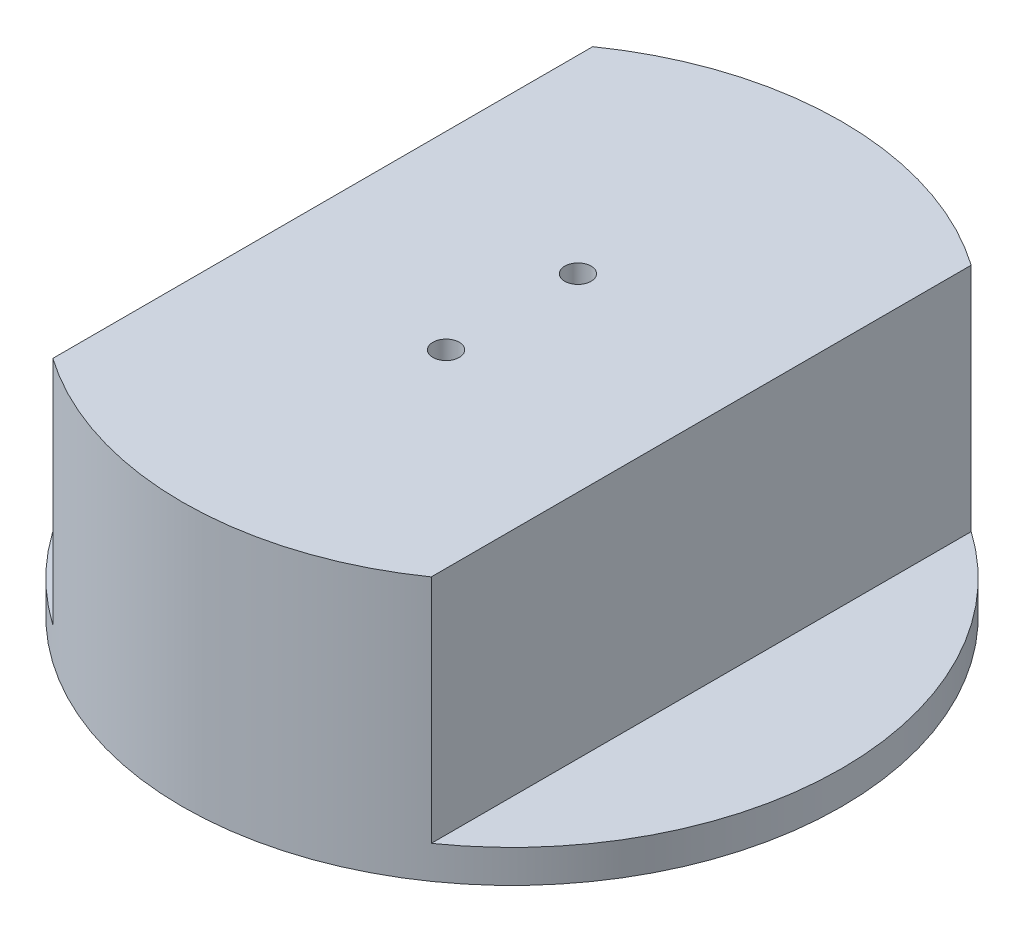
from build123d import *

# Parameters (mm, degrees)
ARA_D_ZLEM_R                = 50
BASE_DEPTH                  = 5
Y_KSEKLIK_EKSTR_ZYON2_DEPTH = 40
IZIM2_R                     = 2
BANANA_SLOTLAR_DEPTH        = 82.240384046


with BuildPart() as part:
    # ara düzlem → base (new body)
    with BuildSketch(Plane(origin=(0, 0, 0), x_dir=(1, 0, 0), z_dir=(0, 1, 0))):
        Circle(ARA_D_ZLEM_R)
    extrude(amount=BASE_DEPTH)

    # Çizim1<3> → Yükseklik-Ekstrüzyon2 (add)
    with BuildSketch(Plane(origin=(0, 0, 0), x_dir=(1, 0, 0), z_dir=(0, 1, 0))):
        with BuildLine():
            ThreePointArc((28.7, 40.942764929), (0, 50), (-28.7, 40.942764929))
            Line((-28.7, 40.942764929), (-28.7, -40.942764929))
            ThreePointArc((-28.7, -40.942764929), (0, -50), (28.7, -40.942764929))
            Line((28.7, -40.942764929), (28.7, 40.942764929))
        make_face()
    extrude(amount=Y_KSEKLIK_EKSTR_ZYON2_DEPTH)

    # Çizim2 → banana slotlar (cut, through all)
    with BuildSketch(Plane(origin=(0, 40, 0), x_dir=(1, 0, 0), z_dir=(0, 1, 0))):
        with Locations((0, 10)):
            Circle(IZIM2_R)
        with Locations((0, -10)):
            Circle(IZIM2_R)
    extrude(amount=-BANANA_SLOTLAR_DEPTH, mode=Mode.SUBTRACT)


solid = part.part
